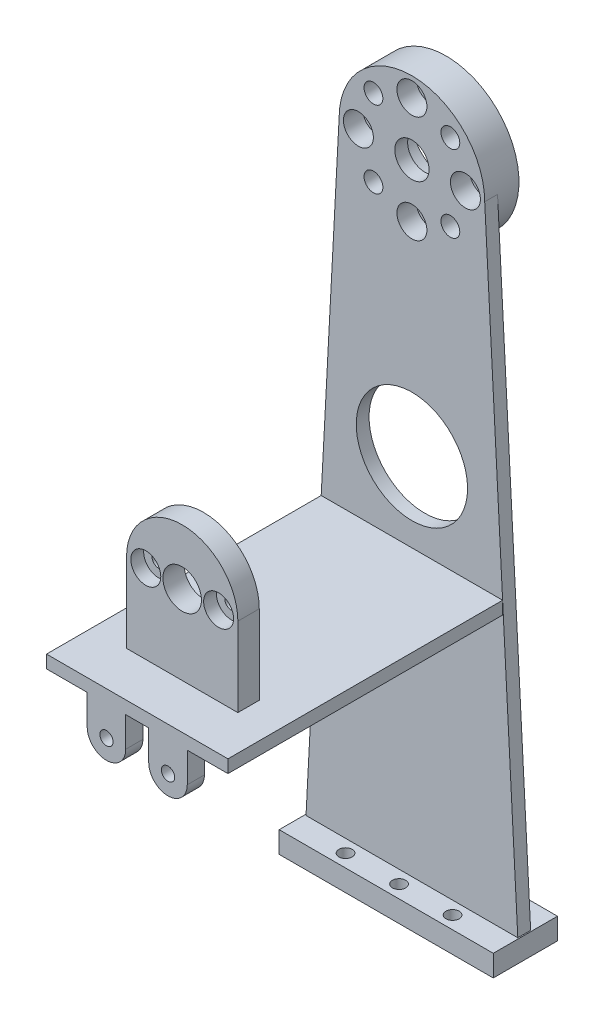
from build123d import *
from build123d.topology import SkipClean

# Parameters (mm, degrees)
SKETCH1_R           = 4
SKETCH1_R_2         = 13
BOSS_EXTRUDE1_DEPTH = 3
BOSS_EXTRUDE2_START = 5
SKETCH2_R           = 17
SKETCH2_R_2         = 8
BOSS_EXTRUDE2_DEPTH = 5
SKETCH3_R           = 1.55
SKETCH3_R_2         = 1
CUT_EXTRUDE1_DEPTH  = 8
SKETCH4_R           = 3.5
SKETCH4_R_2         = 2.2
CUT_EXTRUDE2_DEPTH  = 4.5
SKETCH5_W           = 50
SKETCH5_H           = 15
SKETCH5_R           = 1.55
BOSS_EXTRUDE3_DEPTH = 5
SKETCH9_W           = 42.373333334
SKETCH9_H           = 64.15
BOSS_EXTRUDE6_DEPTH = 3
SKETCH11_R          = 1.55
SKETCH11_R_2        = 4.5
BOSS_EXTRUDE7_DEPTH = 5
SKETCH12_R          = 1.55
BOSS_EXTRUDE8_DEPTH = 4
SKETCH13_R          = 3.5
CUT_EXTRUDE3_DEPTH  = 3


with BuildPart() as part:
    # Sketch1 → Boss-Extrude1 (new body)
    with BuildSketch(Plane.XY):
        with BuildLine():
            Line((-25, 0), (25, 0))
            Line((25, 0), (17, 150))
            ThreePointArc((17, 150), (0, 167), (-17, 150))
            Line((-17, 150), (-25, 0))
        make_face()
        with Locations((0, 150)):
            Circle(SKETCH1_R, mode=Mode.SUBTRACT)
        with Locations((0, 90)):
            Circle(SKETCH1_R_2, mode=Mode.SUBTRACT)
    extrude(amount=BOSS_EXTRUDE1_DEPTH)

    # Sketch2 → Boss-Extrude2 (add)
    with SkipClean():  # the faces are left unmerged after this step: merging them gives an invalid solid
        with BuildSketch(Plane(origin=(0, 0, 0), x_dir=(-1, 0, 0), z_dir=(0, 0, -1)).offset(BOSS_EXTRUDE2_START)):
            with Locations((0, 150)):
                Circle(SKETCH2_R)
            with Locations((0, 150)):
                Circle(SKETCH2_R_2, mode=Mode.SUBTRACT)
        extrude(amount=-BOSS_EXTRUDE2_DEPTH)

    # Sketch3 → Cut-Extrude1 (cut)
    with SkipClean():  # the faces are left unmerged after this step: merging them gives an invalid solid
        with BuildSketch(Plane.XY.offset(3)):
            with Locations((-12.5, 150)):
                Circle(SKETCH3_R)
            with Locations((0, 162.5)):
                Circle(SKETCH3_R)
            with Locations((12.5, 150)):
                Circle(SKETCH3_R)
            with Locations((0, 137.5)):
                Circle(SKETCH3_R)
            with Locations((8.980256121, 158.980256121)):
                Circle(SKETCH3_R_2)
            with Locations((8.980256121, 141.019743879)):
                Circle(SKETCH3_R_2)
            with Locations((-8.980256121, 141.019743879)):
                Circle(SKETCH3_R_2)
            with Locations((-8.980256121, 158.980256121)):
                Circle(SKETCH3_R_2)
        extrude(amount=-CUT_EXTRUDE1_DEPTH, mode=Mode.SUBTRACT)

    # Sketch4 → Cut-Extrude2 (cut)
    with SkipClean():  # the faces are left unmerged after this step: merging them gives an invalid solid
        with BuildSketch(Plane.XY.offset(3)):
            with Locations((-12.5, 150)):
                Circle(SKETCH4_R)
            with Locations((0, 162.5)):
                Circle(SKETCH4_R)
            with Locations((12.5, 150)):
                Circle(SKETCH4_R)
            with Locations((0, 137.5)):
                Circle(SKETCH4_R)
            with Locations((-8.980256121, 158.980256121)):
                Circle(SKETCH4_R_2)
            with Locations((8.980256121, 158.980256121)):
                Circle(SKETCH4_R_2)
            with Locations((8.980256121, 141.019743879)):
                Circle(SKETCH4_R_2)
            with Locations((-8.980256121, 141.019743879)):
                Circle(SKETCH4_R_2)
        extrude(amount=-CUT_EXTRUDE2_DEPTH, mode=Mode.SUBTRACT)

    # Sketch5 → Boss-Extrude3 (add)
    with SkipClean():  # the faces are left unmerged after this step: merging them gives an invalid solid
        with BuildSketch(Plane.XZ):
            with Locations((0, 1.5)):
                Rectangle(SKETCH5_W, SKETCH5_H)
            with Locations((-12.5, 6)):
                Circle(SKETCH5_R, mode=Mode.SUBTRACT)
            with Locations((0, 6)):
                Circle(SKETCH5_R, mode=Mode.SUBTRACT)
            with Locations((12.5, 6)):
                Circle(SKETCH5_R, mode=Mode.SUBTRACT)
            with Locations((0, -3)):
                Circle(SKETCH5_R, mode=Mode.SUBTRACT)
            with Locations((-12.5, -3)):
                Circle(SKETCH5_R, mode=Mode.SUBTRACT)
            with Locations((12.5, -3)):
                Circle(SKETCH5_R, mode=Mode.SUBTRACT)
        extrude(amount=-BOSS_EXTRUDE3_DEPTH)

    # Sketch9 → Boss-Extrude6 (add)
    with SkipClean():  # the faces are left unmerged after this step: merging them gives an invalid solid
        with BuildSketch(Plane.XZ.offset(-71.5)):
            with Locations((0, 35.075)):
                Rectangle(SKETCH9_W, SKETCH9_H)
        extrude(amount=BOSS_EXTRUDE6_DEPTH)

    # Sketch11 → Boss-Extrude7 (add)
    with SkipClean():  # the faces are left unmerged after this step: merging them gives an invalid solid
        with BuildSketch(Plane.XY.offset(51.65)):
            with BuildLine():
                Line((-13, 90), (-13, 71.5))
                Line((-13, 71.5), (13, 71.5))
                Line((13, 71.5), (13, 90))
                ThreePointArc((13, 90), (0, 103), (-13, 90))
            make_face()
            with Locations((-8.5, 90)):
                Circle(SKETCH11_R, mode=Mode.SUBTRACT)
            with Locations((8.5, 90)):
                Circle(SKETCH11_R, mode=Mode.SUBTRACT)
            with Locations((0, 90)):
                Circle(SKETCH11_R_2, mode=Mode.SUBTRACT)
        extrude(amount=BOSS_EXTRUDE7_DEPTH)

    # Sketch12 → Boss-Extrude8 (add)
    # profile 1 of 2: a face of its own
    with SkipClean():  # the faces are left unmerged after this step: merging them gives an invalid solid
        with BuildSketch(Plane.XY.offset(67.15)):
            with BuildLine():
                Line((-11.686666667, 61.5), (-11.686666667, 68.5))
                Line((-11.686666667, 68.5), (-2.686666667, 68.5))
                Line((-2.686666667, 68.5), (-2.686666667, 61.5))
                ThreePointArc((-2.686666667, 61.5), (-7.186666667, 57), (-11.686666667, 61.5))
            make_face()
            with Locations((-7.186666667, 61.5)):
                Circle(SKETCH12_R, mode=Mode.SUBTRACT)
        # profile 2 of 2: a face of its own
        with BuildSketch(Plane.XY.offset(67.15)):
            with BuildLine():
                Line((2.686666667, 61.5), (2.686666667, 68.5))
                Line((2.686666667, 68.5), (11.686666667, 68.5))
                Line((11.686666667, 68.5), (11.686666667, 61.5))
                ThreePointArc((11.686666667, 61.5), (7.186666667, 57), (2.686666667, 61.5))
            make_face()
            with Locations((7.186666667, 61.5)):
                Circle(SKETCH12_R, mode=Mode.SUBTRACT)
        extrude(amount=-BOSS_EXTRUDE8_DEPTH)

    # Sketch13 → Cut-Extrude3 (cut)
    with SkipClean():  # the faces are left unmerged after this step: merging them gives an invalid solid
        with BuildSketch(Plane.XY.offset(56.65)):
            with Locations((-8.5, 90)):
                Circle(SKETCH13_R)
            with Locations((8.5, 90)):
                Circle(SKETCH13_R)
        extrude(amount=-CUT_EXTRUDE3_DEPTH, mode=Mode.SUBTRACT)


solid = part.part
